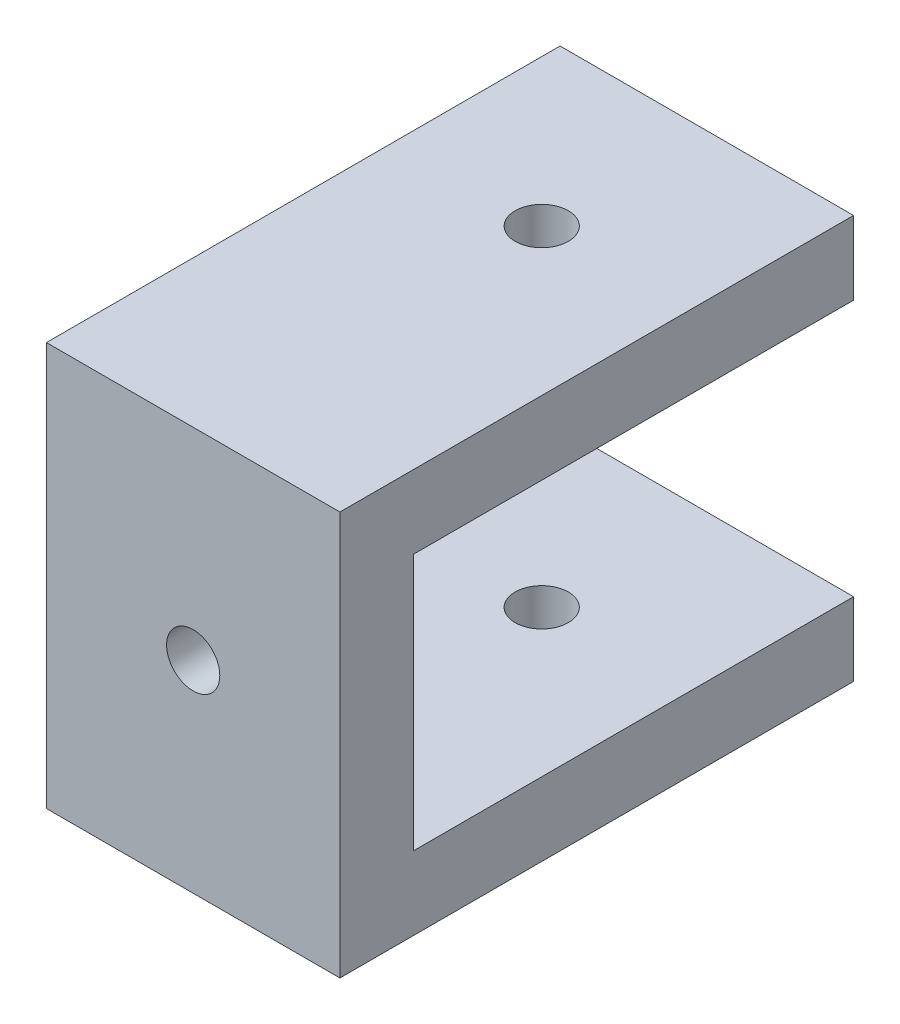
from build123d import *

# Parameters (mm, degrees)
BOSS_EXTRUDE1_DEPTH     = 20.32
CUT_EXTRUDE1_REACH      = 45.273
SKETCH2_R               = 1.8415
CUT_EXTRUDE2_DEPTH      = 47.071427154
CUT_EXTRUDE2_DEPTH_BACK = 47.071427154
SKETCH3_R               = 1.8415


with BuildPart() as part:
    # Sketch1 → Boss-Extrude1 (new body)
    with BuildSketch(Plane(origin=(0, 0, 0), x_dir=(0, 0, -1), z_dir=(1, 0, 0))):
        Polygon((0, 8.89), (0, -8.89), (30.48, -8.89), (30.48, -13.97), (-5.08, -13.97), (-5.08, 13.97), (30.48, 13.97), (30.48, 8.89), align=None)
    extrude(amount=BOSS_EXTRUDE1_DEPTH)

    # Sketch2 → Cut-Extrude1 (cut, up to next)
    with BuildSketch(Plane.XY.offset(5.08), mode=Mode.PRIVATE) as cut_extrude1_sk1:
        with Locations((10.16, 0)):
            Circle(SKETCH2_R)
    cut_extrude1_tool1 = extrude(cut_extrude1_sk1.sketch, amount=-CUT_EXTRUDE1_REACH, mode=Mode.PRIVATE) & part.part
    add(cut_extrude1_tool1.solids().sort_by_distance((10.16, 0, 5.08))[0], mode=Mode.SUBTRACT)

    # Sketch3 → Cut-Extrude2 (cut, two sides: drawn at the far end of the back side and taken through both)
    with BuildSketch(Plane(origin=(0, 13.97, 0), x_dir=(1, 0, 0), z_dir=(0, 1, 0)).offset(-CUT_EXTRUDE2_DEPTH_BACK)):
        with Locations((10.16, 19.05)):
            Circle(SKETCH3_R)
    extrude(amount=CUT_EXTRUDE2_DEPTH + CUT_EXTRUDE2_DEPTH_BACK, mode=Mode.SUBTRACT)


solid = part.part
